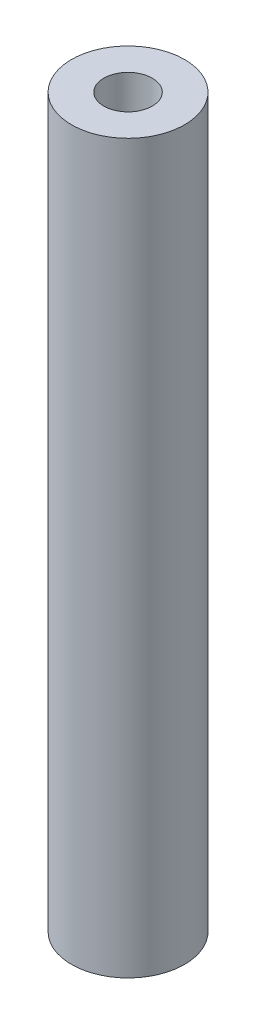
from build123d import *

# Parameters (mm, degrees)
SKETCH1_R           = 7
SKETCH1_R_2         = 3
BOSS_EXTRUDE1_DEPTH = 90


with BuildPart() as part:
    # Sketch1 → Boss-Extrude1 (new body)
    with BuildSketch(Plane(origin=(0, 0, 0), x_dir=(1, 0, 0), z_dir=(0, 1, 0))):
        Circle(SKETCH1_R)
        Circle(SKETCH1_R_2, mode=Mode.SUBTRACT)
    extrude(amount=BOSS_EXTRUDE1_DEPTH)


solid = part.part
